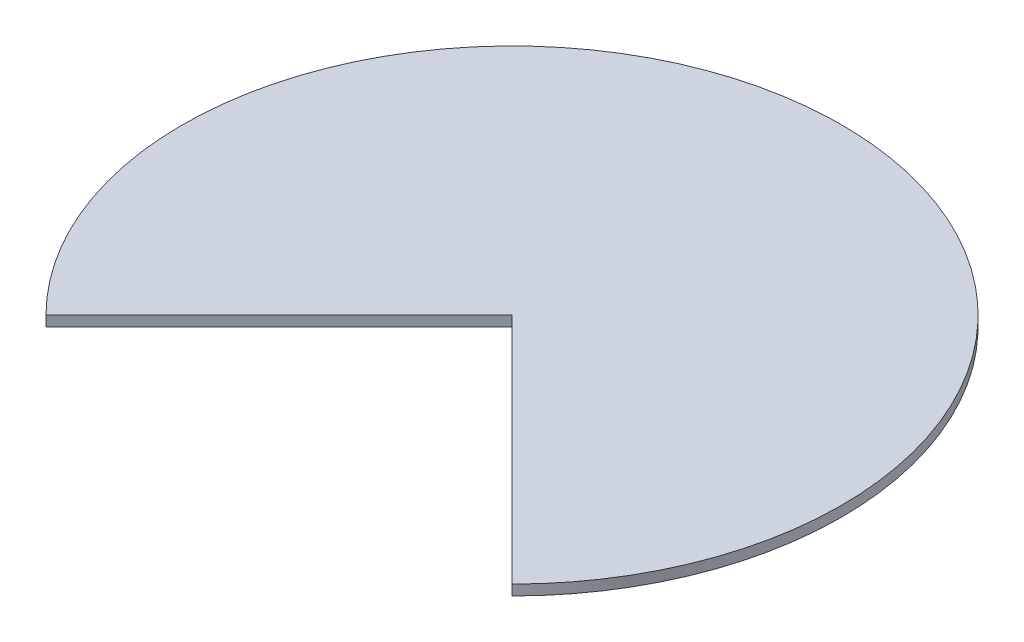
from build123d import *

# Parameters (mm, degrees)
BOSS_EXTRUDE1_DEPTH = 3.175


with BuildPart() as part:
    # Sketch1 → Boss-Extrude1 (new, symmetric)
    with BuildSketch(Plane(origin=(0, 0, 0), x_dir=(1, 0, 0), z_dir=(0, 1, 0))):
        with BuildLine():
            Line((0, 0), (-143.684097937, -143.684097937))
            ThreePointArc((-143.684097937, -143.684097937), (0, 203.2), (143.684097937, -143.684097937))
            Line((143.684097937, -143.684097937), (0, 0))
        make_face()
    extrude(amount=BOSS_EXTRUDE1_DEPTH, both=True)


solid = part.part
